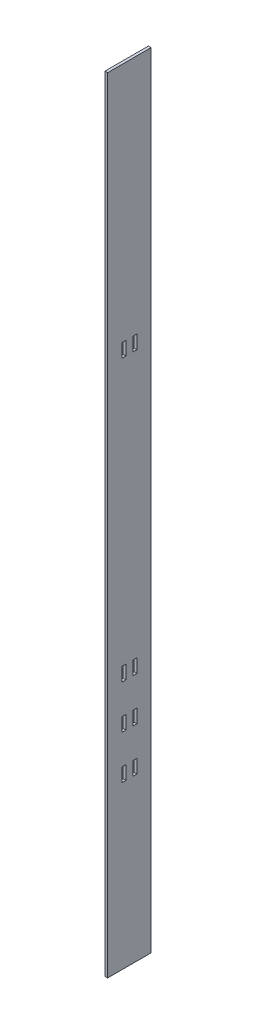
from build123d import *

# Parameters (mm, degrees)
SKETCH1_W                 = 50.8
SKETCH1_H                 = 914.4
BOSS_EXTRUDE1_DEPTH       = 3.175
SKETCH2_W                 = 4.7625
SKETCH2_H                 = 15.875
CUT_EXTRUDE1_DEPTH        = 458.916019184
LPATTERN1_COPY_1_SKETCH_W = 4.7625
LPATTERN1_COPY_1_SKETCH_H = 15.875
LPATTERN1_COPY_1_DEPTH    = 458.916019184
LPATTERN1_COPY_2_SKETCH_W = 4.7625
LPATTERN1_COPY_2_SKETCH_H = 15.875
LPATTERN1_COPY_2_DEPTH    = 458.916019184
LPATTERN1_COPY_3_SKETCH_W = 4.7625
LPATTERN1_COPY_3_SKETCH_H = 15.875
LPATTERN1_COPY_3_DEPTH    = 458.916019184
LPATTERN1_COPY_4_SKETCH_W = 4.7625
LPATTERN1_COPY_4_SKETCH_H = 15.875
LPATTERN1_COPY_4_DEPTH    = 458.916019184
LPATTERN1_COPY_5_SKETCH_W = 4.7625
LPATTERN1_COPY_5_SKETCH_H = 15.875
LPATTERN1_COPY_5_DEPTH    = 458.916019184
LPATTERN1_COPY_6_SKETCH_W = 4.7625
LPATTERN1_COPY_6_SKETCH_H = 15.875
LPATTERN1_COPY_6_DEPTH    = 458.916019184
SKETCH3_W                 = 4.7625
SKETCH3_H                 = 15.875
CUT_EXTRUDE2_DEPTH        = 458.916019184


with BuildPart() as part:
    # Sketch1 → Boss-Extrude1 (new body)
    with BuildSketch(Plane(origin=(0, 0, 0), x_dir=(0, 0, -1), z_dir=(1, 0, 0))):
        Rectangle(SKETCH1_W, SKETCH1_H)
    extrude(amount=BOSS_EXTRUDE1_DEPTH)

    # Sketch2 → Cut-Extrude1 (cut, through all)
    with BuildSketch(Plane(origin=(3.175, 0, 0), x_dir=(0, 0, -1), z_dir=(1, 0, 0))):
        with Locations((6.38125, -209.55)):
            Rectangle(SKETCH2_W, SKETCH2_H)
    cut_extrude1 = extrude(amount=-CUT_EXTRUDE1_DEPTH, mode=Mode.SUBTRACT)

    # Mirror1: Cut-Extrude1 across plane
    add(cut_extrude1.mirror(Plane.XY), mode=Mode.SUBTRACT)

    # LPattern1 copy 1 sketch → LPattern1 copy 1 (cut, through all)
    with BuildSketch(Plane(origin=(3.175, -50.8, 0), x_dir=(0, 0, 1), z_dir=(1, 0, 0))):
        with Locations((6.38125, 209.55)):
            Rectangle(LPATTERN1_COPY_1_SKETCH_W, LPATTERN1_COPY_1_SKETCH_H)
    extrude(amount=-LPATTERN1_COPY_1_DEPTH, mode=Mode.SUBTRACT)

    # LPattern1 copy 2 sketch → LPattern1 copy 2 (cut, through all)
    with BuildSketch(Plane(origin=(3.175, 50.8, 0), x_dir=(0, 0, 1), z_dir=(1, 0, 0))):
        with Locations((6.38125, 209.55)):
            Rectangle(LPATTERN1_COPY_2_SKETCH_W, LPATTERN1_COPY_2_SKETCH_H)
    extrude(amount=-LPATTERN1_COPY_2_DEPTH, mode=Mode.SUBTRACT)

    # LPattern1 copy 3 sketch → LPattern1 copy 3 (cut, through all)
    with BuildSketch(Plane(origin=(3.175, 0, 0), x_dir=(0, 0, 1), z_dir=(1, 0, 0))):
        with Locations((6.38125, 209.55)):
            Rectangle(LPATTERN1_COPY_3_SKETCH_W, LPATTERN1_COPY_3_SKETCH_H)
    extrude(amount=-LPATTERN1_COPY_3_DEPTH, mode=Mode.SUBTRACT)

    # LPattern1 copy 4 sketch → LPattern1 copy 4 (cut, through all)
    with BuildSketch(Plane(origin=(3.175, -50.8, 0), x_dir=(0, 0, -1), z_dir=(1, 0, 0))):
        with Locations((6.38125, -209.55)):
            Rectangle(LPATTERN1_COPY_4_SKETCH_W, LPATTERN1_COPY_4_SKETCH_H)
    extrude(amount=-LPATTERN1_COPY_4_DEPTH, mode=Mode.SUBTRACT)

    # LPattern1 copy 5 sketch → LPattern1 copy 5 (cut, through all)
    with BuildSketch(Plane(origin=(3.175, 50.8, 0), x_dir=(0, 0, -1), z_dir=(1, 0, 0))):
        with Locations((6.38125, -209.55)):
            Rectangle(LPATTERN1_COPY_5_SKETCH_W, LPATTERN1_COPY_5_SKETCH_H)
    extrude(amount=-LPATTERN1_COPY_5_DEPTH, mode=Mode.SUBTRACT)

    # LPattern1 copy 6 sketch → LPattern1 copy 6 (cut, through all)
    with BuildSketch(Plane(origin=(3.175, 0, 0), x_dir=(0, 0, -1), z_dir=(1, 0, 0))):
        with Locations((6.38125, -209.55)):
            Rectangle(LPATTERN1_COPY_6_SKETCH_W, LPATTERN1_COPY_6_SKETCH_H)
    extrude(amount=-LPATTERN1_COPY_6_DEPTH, mode=Mode.SUBTRACT)

    # Sketch3 → Cut-Extrude2 (cut, through all)
    with BuildSketch(Plane(origin=(3.175, 0, 0), x_dir=(0, 0, -1), z_dir=(1, 0, 0))):
        with Locations((6.38125, 168.275)):
            Rectangle(SKETCH3_W, SKETCH3_H)
        with Locations((-6.38125, 168.275)):
            Rectangle(SKETCH3_W, SKETCH3_H)
    extrude(amount=-CUT_EXTRUDE2_DEPTH, mode=Mode.SUBTRACT)


solid = part.part
